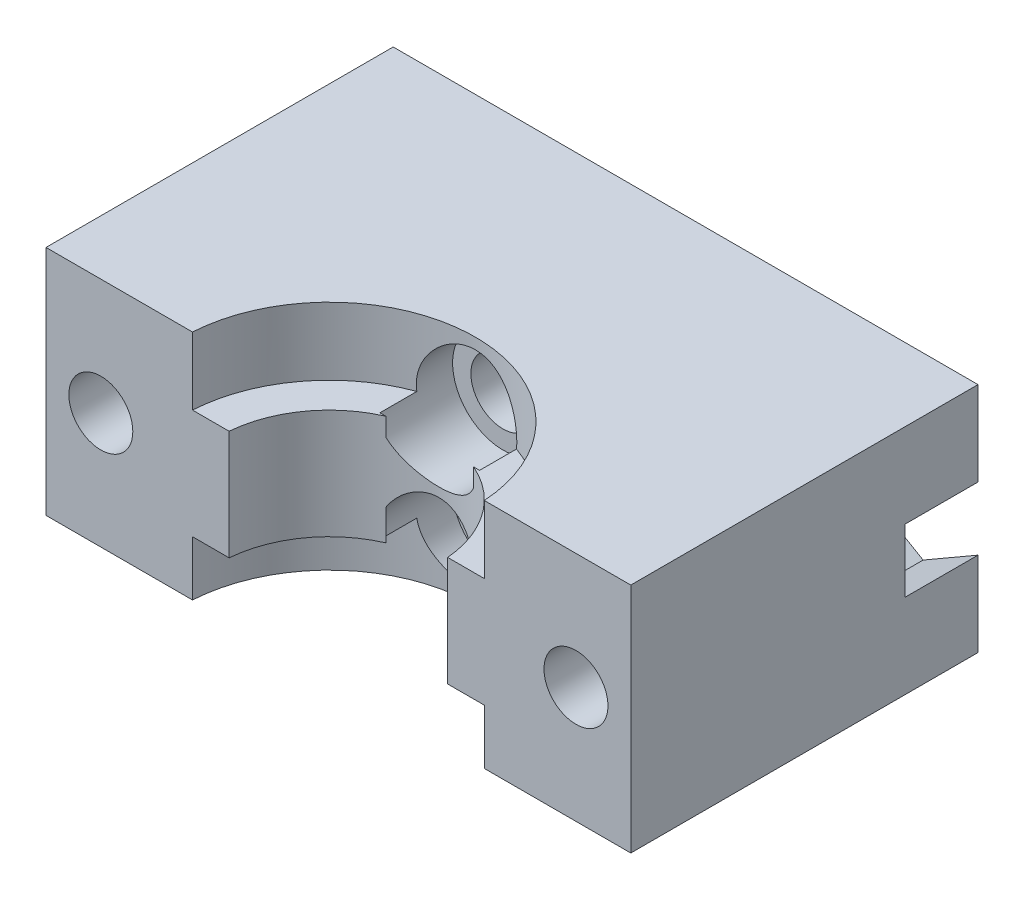
from build123d import *

# Parameters (mm, degrees)
SKETCH2_W           = 32
SKETCH2_H           = 12.7
SKETCH2_R           = 1.75
BOSS_EXTRUDE1_DEPTH = 19
SKETCH3_R           = 1.75
CUT_EXTRUDE1_DEPTH  = 26.638301426
CUT_EXTRUDE2_DEPTH  = 4
SKETCH5_R           = 8
CUT_EXTRUDE3_DEPTH  = 3.7
SKETCH9_R           = 6
CUT_EXTRUDE5_DEPTH  = 6
SKETCH10_R          = 8
CUT_EXTRUDE6_DEPTH  = 27.666270938
SKETCH6_R           = 2.75
CUT_EXTRUDE4_DEPTH  = 4


with BuildPart() as part:
    # Sketch2 → Boss-Extrude1 (new body)
    with BuildSketch(Plane.XY):
        Rectangle(SKETCH2_W, SKETCH2_H)
        with Locations((0, 3)):
            Circle(SKETCH2_R, mode=Mode.SUBTRACT)
        with Locations((0, -3)):
            Circle(SKETCH2_R, mode=Mode.SUBTRACT)
    extrude(amount=BOSS_EXTRUDE1_DEPTH)

    # Sketch3 → Cut-Extrude1 (cut, through all)
    with BuildSketch(Plane.XY.offset(19)):
        with Locations((-13, 0)):
            Circle(SKETCH3_R)
        with Locations((13, 0)):
            Circle(SKETCH3_R)
    extrude(amount=-CUT_EXTRUDE1_DEPTH, mode=Mode.SUBTRACT)

    # Sketch4 → Cut-Extrude2 (cut)
    with BuildSketch(Plane(origin=(0, 0, 0), x_dir=(-1, 0, 0), z_dir=(0, 0, -1))):
        Polygon((-10, -1.732050808), (-10, 1.732050808), (-13, 3.464101615), (-16, 1.732050808), (-16, -1.732050808), (-13, -3.464101615), align=None)
        Polygon((13, -3.464101615), (16, -1.732050808), (16, 1.732050808), (13, 3.464101615), (10, 1.732050808), (10, -1.732050808), align=None)
    extrude(amount=-CUT_EXTRUDE2_DEPTH, mode=Mode.SUBTRACT)

    # Sketch5 → Cut-Extrude3 (cut)
    with BuildSketch(Plane(origin=(0, 6.35, 0), x_dir=(1, 0, 0), z_dir=(0, 1, 0))):
        with Locations((0, -19.5)):
            Circle(SKETCH5_R)
    extrude(amount=-CUT_EXTRUDE3_DEPTH, mode=Mode.SUBTRACT)

    # Sketch9 → Cut-Extrude5 (cut)
    with BuildSketch(Plane(origin=(0, 2.65, 0), x_dir=(1, 0, 0), z_dir=(0, 1, 0))):
        with Locations((0, -19.5)):
            Circle(SKETCH9_R)
    extrude(amount=-CUT_EXTRUDE5_DEPTH, mode=Mode.SUBTRACT)

    # Sketch10 → Cut-Extrude6 (cut, through all)
    with BuildSketch(Plane(origin=(0, -3.35, 0), x_dir=(1, 0, 0), z_dir=(0, 1, 0))):
        with Locations((0, -19.5)):
            Circle(SKETCH10_R)
    extrude(amount=-CUT_EXTRUDE6_DEPTH, mode=Mode.SUBTRACT)

    # Sketch6 → Cut-Extrude4 (cut)
    with BuildSketch(Plane.XY.offset(14)):
        with Locations((0, 3)):
            Circle(SKETCH6_R)
        with Locations((0, -3)):
            Circle(SKETCH6_R)
    extrude(amount=-CUT_EXTRUDE4_DEPTH, mode=Mode.SUBTRACT)


solid = part.part
